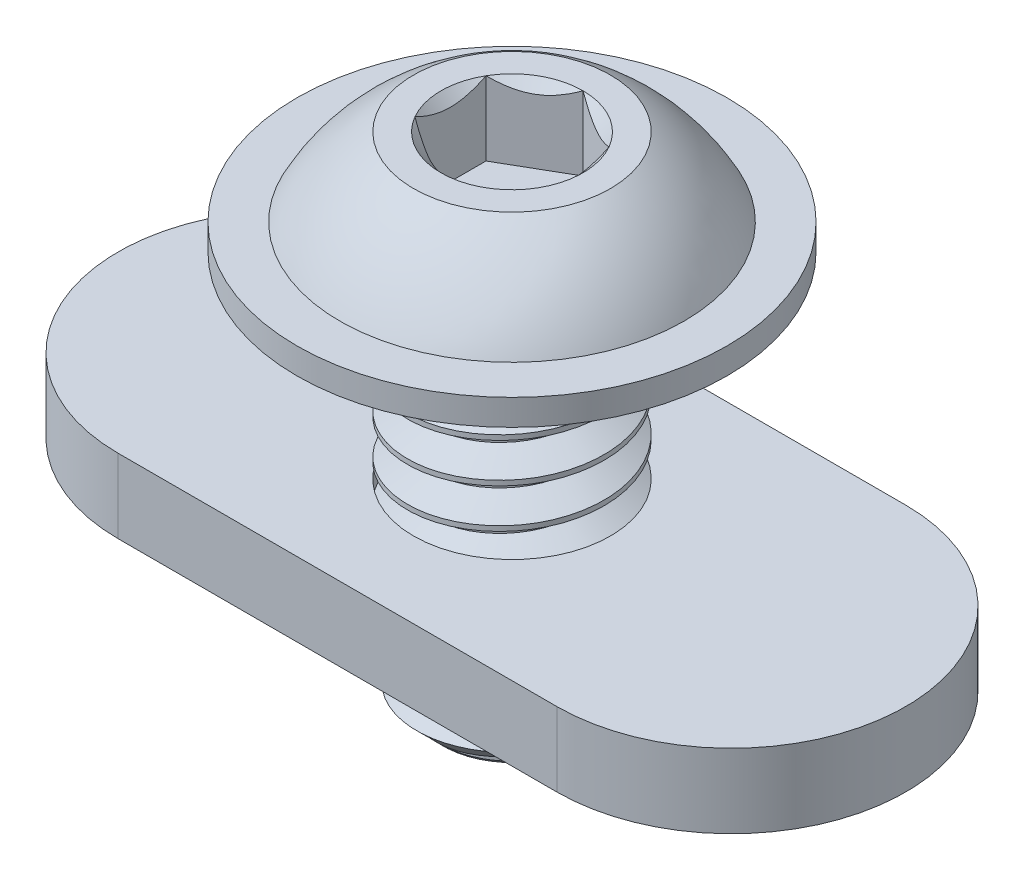
from build123d import *

# Parameters (mm, degrees)
SKETCH1_R           = 3.175
BOSS_EXTRUDE1_DEPTH = 12.7
CUT_SWEEP1_PITCH    = 1.27
SKETCH4_OUTSIDE_W   = 14
SKETCH4_OUTSIDE_H   = 14
SKETCH4_OUTSIDE_R   = 2.21262927
CUT_EXTRUDE1_DEPTH  = 1.27
CUT_EXTRUDE1_DRAFT  = -45
CUT_EXTRUDE2_DEPTH  = 2.38125
BOSS_EXTRUDE2_START = -6.35
SKETCH8_R           = 3.175
BOSS_EXTRUDE2_DEPTH = 2.3876
SKETCH9_R           = 3.5687
SKETCH9_R_2         = 3.175
BOSS_EXTRUDE3_DEPTH = 0.762


with BuildPart() as part:
    # Sketch1 → Boss-Extrude1 (new body)
    with BuildSketch(Plane(origin=(0, 0, 0), x_dir=(1, 0, 0), z_dir=(0, 1, 0))):
        with Locations(Location((0, 0, 0), (0, 0, 270))):
            Circle(SKETCH1_R)
    extrude(amount=-BOSS_EXTRUDE1_DEPTH)

    # Cut-Sweep1: the profile of Sketch3 screwed along a right-hand helix of 11 turns, 8 arcs to a turn; built about Z, then put on its axis
    cut_sweep1_z = Axis((0, 0, 0), (0, 0, 1))
    cut_sweep1_corners = [(2.350110803, 0, -0.47625), (3.243740766, 0, 0.0396875), (3.243740766, 0, -1.1509375), (2.350110803, 0, -0.635)]
    with BuildLine(mode=Mode.PRIVATE) as cut_sweep1_profile:
        Line(cut_sweep1_corners[0], cut_sweep1_corners[1])
        Line(cut_sweep1_corners[1], cut_sweep1_corners[2])
        Line(cut_sweep1_corners[2], cut_sweep1_corners[3])
        Line(cut_sweep1_corners[3], cut_sweep1_corners[0])
    cut_sweep1_cap = Face(cut_sweep1_profile.wire())
    cut_sweep1_turn_angles = [0, 22.5, 45, 67.5, 90, 112.5, 135, 157.5, 180, 202.5, 225, 247.5, 270, 292.5, 315, 337.5, 360]
    cut_sweep1_turn_weights = [1, 0.9238795325112867, 1, 0.9238795325112867, 1, 0.9238795325112867, 1, 0.9238795325112867, 1, 0.9238795325112867, 1, 0.9238795325112867, 1, 0.9238795325112867, 1, 0.9238795325112867, 1]
    cut_sweep1_turn_rails = [Edge.make_bspline([Vector(p[0], p[1], 0).rotate(cut_sweep1_z, cut_sweep1_turn_angles[k]) / cut_sweep1_turn_weights[k] + Vector(0, 0, p[2] + CUT_SWEEP1_PITCH * cut_sweep1_turn_angles[k] / 360) for k in range(17)], [0, 0, 0, 1, 1, 2, 2, 3, 3, 4, 4, 5, 5, 6, 6, 7, 7, 8, 8, 8], 2, cut_sweep1_turn_weights) for p in cut_sweep1_corners]
    cut_sweep1_turn_sides = [Face.make_surface_from_curves(cut_sweep1_turn_rails[p[0]], cut_sweep1_turn_rails[p[1]]) for p in [(0, 1), (1, 2), (2, 3), (3, 0)]]
    cut_sweep1 = Plane(origin=(0, -12.7, 0), x_dir=(0, 0, -1), z_dir=(0, 1, 0)) * Solid(Shell([*[p.moved(Location((0, 0, CUT_SWEEP1_PITCH * i))) for i in range(11) for p in cut_sweep1_turn_sides], cut_sweep1_cap, cut_sweep1_cap.rotate(cut_sweep1_z, 3960).moved(Location((0, 0, CUT_SWEEP1_PITCH * 3960 / 360)))]))
    add(cut_sweep1, mode=Mode.SUBTRACT)


with BuildPart() as cut_extrude1_tool:
    # Sketch4 outside → Cut-Extrude1 (with draft: the straight prism first)
    with BuildSketch(Plane.XZ.offset(12.7)):
        Rectangle(SKETCH4_OUTSIDE_W, SKETCH4_OUTSIDE_H)
        Circle(SKETCH4_OUTSIDE_R, mode=Mode.SUBTRACT)
    extrude(amount=-CUT_EXTRUDE1_DEPTH)
    # Cut-Extrude1: the draft: its side faces are tilted about the plane it starts from
    cut_extrude1_sides = [cut_extrude1_tool.faces().sort_by_distance(p)[0] for p in [
        (0, -12.065, -7),
        (7, -12.065, 0),
        (0, -12.065, 7),
        (-7, -12.065, 0),
        (-2.21262927, -12.065, 0),
    ]]
    draft(cut_extrude1_sides, Plane.XZ.offset(12.7), CUT_EXTRUDE1_DRAFT)


with BuildPart() as part_1:
    add(part.part)

    # Cut-Extrude1: cut by cut_extrude1_tool
    add(cut_extrude1_tool.part, mode=Mode.SUBTRACT)

    # Sketch5 → Revolve1 (revolve)
    with BuildSketch(Plane.XY, mode=Mode.PRIVATE) as revolve1_sk:
        with BuildLine():
            Line((0, 0), (0, 3.3528))
            Line((0, 3.3528), (-3.175, 3.3528))
            ThreePointArc((-3.175, 3.3528), (-4.540019085, 2.263204136), (-5.5499, 0.8382))
            Line((-5.5499, 0.8382), (-6.9342, 0.8382))
            Line((-6.9342, 0.8382), (-6.9342, 0))
            Line((-6.9342, 0), (0, 0))
        make_face()
    revolve(revolve1_sk.sketch.rotate(Axis((0, 0, 0), (0, 1, 0)), 270), axis=Axis((0, 0, 0), (0, 1, 0)))

    # Sketch6 → Cut-Extrude2 (cut)
    with BuildSketch(Plane(origin=(0, 3.3528, 0), x_dir=(1, 0, 0), z_dir=(0, 1, 0))):
        Polygon((0, 2.291358881), (-1.984375, 1.14567944), (-1.984375, -1.14567944), (0, -2.291358881), (1.984375, -1.14567944), (1.984375, 1.14567944), align=None)
    extrude(amount=-CUT_EXTRUDE2_DEPTH, mode=Mode.SUBTRACT)

    # Cut-Extrude3 cone 1 section (through the dimple's axis) → Cut-Extrude3 (revolve, cut)
    with BuildSketch(Plane(origin=(0, 3.3528, 0), x_dir=(0, 0, 1), z_dir=(1, 0, 0))):
        Polygon((0, 0), (2.291358881, 0), (0, 2.291358881), align=None)
    revolve(axis=Axis((0, 3.3528, 0), (0, -1, 0)), mode=Mode.SUBTRACT)


with BuildPart() as body_2:
    # Sketch8 → Boss-Extrude2 (new body)
    with BuildSketch(Plane(origin=(0, 0, 0), x_dir=(1, 0, 0), z_dir=(0, 1, 0)).offset(BOSS_EXTRUDE2_START)):
        with BuildLine():
            Line((-7.0739, 5.6261), (7.0739, 5.6261))
            ThreePointArc((7.0739, 5.6261), (12.7, 0), (7.0739, -5.6261))
            Line((7.0739, -5.6261), (-7.0739, -5.6261))
            ThreePointArc((-7.0739, -5.6261), (-12.7, 0), (-7.0739, 5.6261))
        make_face()
        with Locations(Location((0, 0, 0), (0, 0, 270))):
            Circle(SKETCH8_R, mode=Mode.SUBTRACT)
    extrude(amount=-BOSS_EXTRUDE2_DEPTH)

    # Sketch9 → Boss-Extrude3 (add)
    with BuildSketch(Plane.XZ.offset(8.7376)):
        with Locations(Location((0, 0, 0), (0, 0, 90))):
            Circle(SKETCH9_R)
        with Locations(Location((0, 0, 0), (0, 0, 90))):
            Circle(SKETCH9_R_2, mode=Mode.SUBTRACT)
    extrude(amount=BOSS_EXTRUDE3_DEPTH)


solid = Compound([part_1.part, body_2.part])
